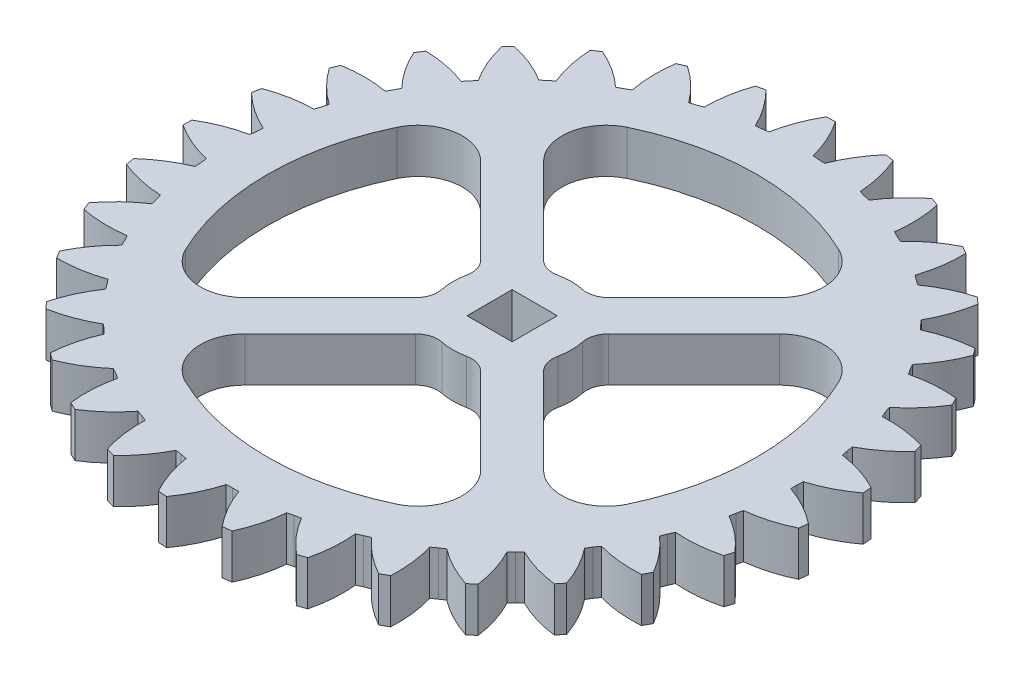
from build123d import *

# Parameters (mm, degrees)
BOSS_EXTRUDE1_DEPTH      = 1.5
CIRPATTERN1_COUNT        = 33
SKETCH4_W                = 3.05
SKETCH4_H                = 3.05
CUT_EXTRUDE1_DEPTH       = 32.641222001
CUT_EXTRUDE2_DEPTH       = 32.641222001
FILLET1_R                = 3
FILLET2_R                = 1.5
CIRPATTERN4_COUNT        = 4
FILLET1_OF_CIRPATTERN4_R = 3
FILLET2_OF_CIRPATTERN4_R = 1.5


with BuildPart() as part:
    # Sketch6 → Boss-Extrude1 (new, symmetric)
    with BuildSketch(Plane(origin=(0, 0, 0), x_dir=(1, 0, 0), z_dir=(0, 1, 0))):
        with BuildLine():
            Line((0, 0), (19.230668789, 3.406942702))
            ThreePointArc((19.230668789, 3.406942702), (19.269891333, 3.202778986), (19.315001591, 2.999834916))
            ThreePointArc((19.315001591, 2.999834916), (20.785797604, 2.661916254), (22.177775211, 2.078968338))
            Line((22.177775211, 2.078968338), (22.201536915, 1.783112977))
            Line((22.201536915, 1.783112977), (22.225298367, 1.487257597))
            ThreePointArc((22.225298367, 1.487257597), (20.944202096, 0.689622169), (19.546191018, 0.121295712))
            ThreePointArc((19.546191018, 0.121295712), (19.534048908, -0.086246573), (19.527913697, -0.294053189))
            Line((19.527913697, -0.294053189), (0, 0))
        make_face()
    boss_extrude1 = extrude(amount=BOSS_EXTRUDE1_DEPTH, both=True)

    # CirPattern1: Boss-Extrude1 ×33 about axis
    cirpattern1_axis = Axis((0, -1.5, 0), (0, 1, 0))
    for i in range(1, CIRPATTERN1_COUNT):
        add(boss_extrude1.rotate(cirpattern1_axis, i * 360 / CIRPATTERN1_COUNT))

    # Sketch4 → Cut-Extrude1 (cut, through all)
    with BuildSketch(Plane(origin=(0, 1.5, 0), x_dir=(1, 0, 0), z_dir=(0, 1, 0))):
        Rectangle(SKETCH4_W, SKETCH4_H)
    extrude(amount=-CUT_EXTRUDE1_DEPTH, mode=Mode.SUBTRACT)

    # Sketch5 → Cut-Extrude2 (cut, through all)
    with BuildSketch(Plane(origin=(0, 1.5, 0), x_dir=(1, 0, 0), z_dir=(0, 1, 0))):
        with BuildLine():
            Line((3.682682292, 1.561361949), (12.705276463, 10.583956119))
            ThreePointArc((12.705276463, 10.583956119), (16.53614759, 0), (12.705276463, -10.583956119))
            Line((12.705276463, -10.583956119), (3.682682292, -1.561361949))
            ThreePointArc((3.682682292, -1.561361949), (4, 0), (3.682682292, 1.561361949))
        make_face()
    cut_extrude2 = extrude(amount=-CUT_EXTRUDE2_DEPTH, mode=Mode.SUBTRACT)

    # Fillet1
    fillet1_edges = [part.edges().sort_by_distance(p)[0] for p in [
        (12.705276463, 0, 10.583956119),
        (12.705276463, 0, -10.583956119),
    ]]
    fillet(fillet1_edges, radius=FILLET1_R)

    # Fillet2
    fillet2_edges = [part.edges().sort_by_distance(p)[0] for p in [
        (3.682682292, 0, 1.561361949),
        (3.682682292, 0, -1.561361949),
    ]]
    fillet(fillet2_edges, radius=FILLET2_R)

    # CirPattern4: Cut-Extrude2 ×4 about axis
    cirpattern4_axis = Axis((0, -1.74625, 0), (0, 1, 0))
    for i in range(1, CIRPATTERN4_COUNT):
        add(cut_extrude2.rotate(cirpattern4_axis, i * 360 / CIRPATTERN4_COUNT), mode=Mode.SUBTRACT)

    # Fillet1 of CirPattern4
    fillet1_of_cirpattern4_edges = [part.edges().sort_by_distance(p)[0] for p in [
        (10.583956119, 0, -12.705276463),
        (-10.583956119, 0, -12.705276463),
        (-12.705276463, 0, -10.583956119),
        (-12.705276463, 0, 10.583956119),
        (-10.583956119, 0, 12.705276463),
        (10.583956119, 0, 12.705276463),
    ]]
    fillet(fillet1_of_cirpattern4_edges, radius=FILLET1_OF_CIRPATTERN4_R)

    # Fillet2 of CirPattern4
    fillet2_of_cirpattern4_edges = [part.edges().sort_by_distance(p)[0] for p in [
        (1.561361949, 0, -3.682682292),
        (-1.561361949, 0, -3.682682292),
        (-3.682682292, 0, -1.561361949),
        (-3.682682292, 0, 1.561361949),
        (-1.561361949, 0, 3.682682292),
        (1.561361949, 0, 3.682682292),
    ]]
    fillet(fillet2_of_cirpattern4_edges, radius=FILLET2_OF_CIRPATTERN4_R)


solid = part.part
